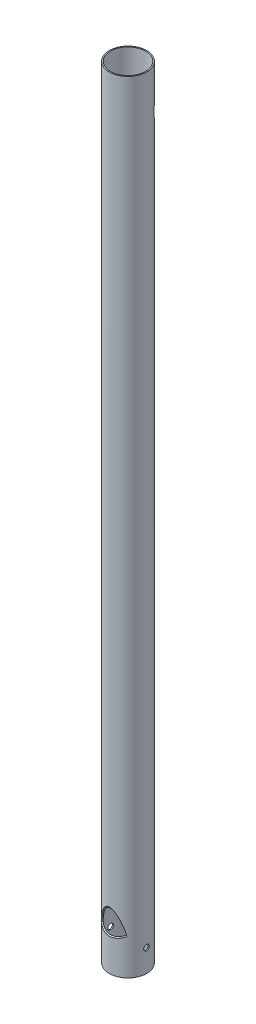
from build123d import *

# Parameters (mm, degrees)
EXTRUDE_1_OUTLINE_R      = 66.5
EXTRUDE_1_OUTLINE_R_2    = 62.5
EXTRUDE_1_DEPTH          = 2780
CUT_EXTRUDE_3_DEPTH      = 2782.590282554
CUT_EXTRUDE_3_DEPTH_BACK = 2782.590282554
SKETCH_6_R               = 10
SKETCH_7_R               = 50
CUT_EXTRUDE_4_DEPTH      = 200
SKETCH_10_R              = 55
CUT_EXTRUDE_5_DEPTH      = 2782.590282659
SKETCH_13_R              = 52.5
CUT_EXTRUDE_8_DEPTH      = 200


# Read off the part's stored shape, not the designer's step: Вытянуть-Тонкостенный1
with BuildPart() as part:
    # Вытянуть-Тонкостенный1 outline → Вытянуть-Тонкостенный1 (new body)
    with BuildSketch(Plane(origin=(0, 0, 0), x_dir=(1, 0, 0), z_dir=(0, 1, 0))):
        Circle(EXTRUDE_1_OUTLINE_R)
        Circle(EXTRUDE_1_OUTLINE_R_2, mode=Mode.SUBTRACT)
    extrude(amount=EXTRUDE_1_DEPTH)

    # Эскиз6 → Вырез-Вытянуть3 (cut, two sides: drawn at the far end of the back side and taken through both)
    with BuildSketch(Plane(origin=(0, 0, 0), x_dir=(0, 0, -1), z_dir=(1, 0, 0)).offset(-CUT_EXTRUDE_3_DEPTH_BACK)):
        with Locations((0, 80)):
            Circle(SKETCH_6_R)
    extrude(amount=CUT_EXTRUDE_3_DEPTH + CUT_EXTRUDE_3_DEPTH_BACK, mode=Mode.SUBTRACT)

    # Эскиз7 → Вырез-Вытянуть4 (cut)
    with BuildSketch(Plane(origin=(0, 272.455155936, 190.775154011), x_dir=(1, 0, 0), z_dir=(0, -0.8191520442889889, -0.5735764363510502))):
        with Locations((0, -13.154034206)):
            Circle(SKETCH_7_R)
    extrude(amount=CUT_EXTRUDE_4_DEPTH, mode=Mode.SUBTRACT)

    # Эскиз10 → Вырез-Вытянуть5 (cut, through all)
    with BuildSketch(Plane.XY):
        with Locations(Location((0, 2630, 0), (0, 0, 90))):
            Circle(SKETCH_10_R)
    extrude(amount=-CUT_EXTRUDE_5_DEPTH, mode=Mode.SUBTRACT)

    # Эскиз13 → Вырез-Вытянуть8 (cut)
    with BuildSketch(Plane(origin=(0, 1533.697054216, 1073.906238692), x_dir=(1, 0, 0), z_dir=(0, -0.8191520442889889, -0.5735764363510502))):
        with Locations((0, -1530.736872885)):
            Circle(SKETCH_13_R)
    extrude(amount=-CUT_EXTRUDE_8_DEPTH, mode=Mode.SUBTRACT)


solid = part.part
